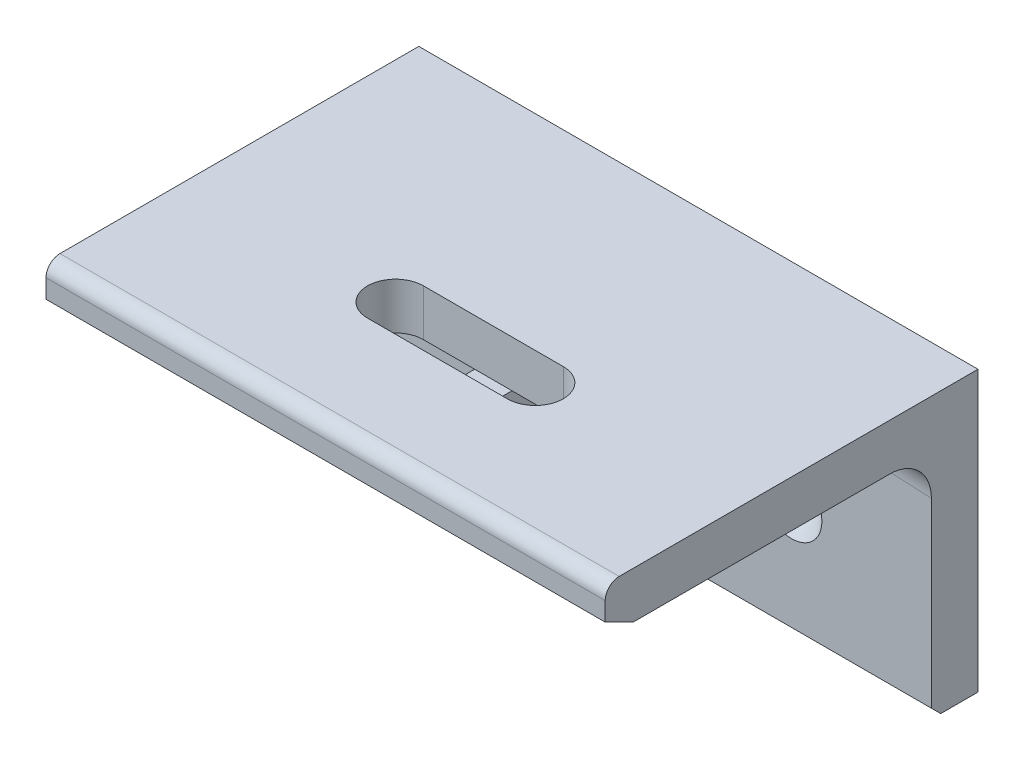
from build123d import *

# Parameters (mm, degrees)
SKETCH_1_W                     = 120
SKETCH_1_H                     = 60
EXTRUDE_1_DEPTH                = 10
SKETCH_2_W                     = 120
SKETCH_2_H                     = 80
EXTRUDE_2_DEPTH                = 10
EXTRUDE_3_DEPTH                = 8
CUT_EXTRUDE_13_DEPTH           = 157.974520392
FILLET_1_R                     = 3
CHAMFER_1_SIZE                 = 2
SKETCH_18_R                    = 6.5
CUT_EXTRUDE_14_DEPTH           = 3.2
CUT_EXTRUDE_14_DRAFT           = -45
CUT_EXTRUDE_14_PROFILE_2_DEPTH = 3.2
CUT_EXTRUDE_14_PROFILE_2_DRAFT = -45
SKETCH_19_R                    = 3.3
CUT_EXTRUDE_15_DEPTH           = 152.327459669
CUT_EXTRUDE_19_DEPTH           = 10


with BuildPart() as part:
    # 草图1 → 凸台-拉伸1 (new body)
    with BuildSketch(Plane.XY):
        with Locations((60, 30)):
            Rectangle(SKETCH_1_W, SKETCH_1_H)
    extrude(amount=EXTRUDE_1_DEPTH)

    # 草图2 → 凸台-拉伸2 (add)
    with BuildSketch(Plane(origin=(0, 50, 0), x_dir=(1, 0, 0), z_dir=(0, 1, 0))):
        with Locations((60, -40)):
            Rectangle(SKETCH_2_W, SKETCH_2_H)
    extrude(amount=EXTRUDE_2_DEPTH)

    # 草图10 for 放样2 → 放样2 section 0
    with BuildSketch(Plane(origin=(0, 0, 0), x_dir=(0, 0, -1), z_dir=(1, 0, 0))):
        with BuildLine():
            Line((-10, 50), (-10, 47))
            # circular arc as an exact rational Bezier (weights 1, cos(half-angle), 1)
            Bezier((-10, 47), (-10, 50), (-13, 50), weights=[1, 0.707106781, 1])
            Line((-13, 50), (-10, 50))
        make_face()
    # 草图11 for 放样2 → 放样2 section 1
    with BuildSketch(Plane(origin=(120, 0, 0), x_dir=(0, 0, -1), z_dir=(1, 0, 0))):
        with BuildLine():
            Line((-10, 50), (-10, 41))
            Bezier((-10, 41), (-10, 50), (-19, 50), weights=[1, 0.707106781, 1])
            Line((-19, 50), (-10, 50))
        make_face()
    loft()

    # 草图14 → 凸台-拉伸3 (add)
    with BuildSketch(Plane(origin=(56, 0, 0), x_dir=(0, 0, -1), z_dir=(1, 0, 0))):
        Polygon((-10, 50), (-10, 10), (-60, 50), align=None)
    extrude(amount=EXTRUDE_3_DEPTH)

    # 草图17 → 切除-拉伸13 (cut, through all)
    with BuildSketch(Plane(origin=(-1, 0, 0), x_dir=(0, 0, -1), z_dir=(1, 0, 0))):
        Polygon((-80, 50), (-74, 50), (-80, 53), align=None)
    extrude(amount=CUT_EXTRUDE_13_DEPTH, mode=Mode.SUBTRACT)

    # 圆角1
    fillet_1_edges = [part.edges().sort_by_distance(p)[0] for p in [
        (60, 60, 80),
    ]]
    fillet(fillet_1_edges, radius=FILLET_1_R)

    # 倒角1
    chamfer_1_edges = [part.edges().sort_by_distance(p)[0] for p in [
        (60, 0, 10),
    ]]
    chamfer(chamfer_1_edges, length=CHAMFER_1_SIZE)


with BuildPart() as cut_extrude_14_tool:
    # 草图18 → 切除-拉伸14 (with draft: the straight prism first)
    with BuildSketch(Plane.XY.offset(10)):
        with Locations((30, 25)):
            Circle(SKETCH_18_R)
    extrude(amount=-CUT_EXTRUDE_14_DEPTH)
    # 切除-拉伸14: the draft: its side faces are tilted about the plane it starts from
    cut_extrude_14_sides = [cut_extrude_14_tool.faces().sort_by_distance(p)[0] for p in [
        (23.5, 25, 8.4),
    ]]
    draft(cut_extrude_14_sides, Plane.XY.offset(10), CUT_EXTRUDE_14_DRAFT)


with BuildPart() as part_1:
    add(part.part)

    # 切除-拉伸14: cut by cut_extrude_14_tool
    add(cut_extrude_14_tool.part, mode=Mode.SUBTRACT)


with BuildPart() as cut_extrude_14_profile_2_tool:
    # 草图18 → 切除-拉伸14 profile 2 (with draft: the straight prism first)
    with BuildSketch(Plane.XY.offset(10)):
        with Locations((90, 25)):
            Circle(SKETCH_18_R)
    extrude(amount=-CUT_EXTRUDE_14_PROFILE_2_DEPTH)
    # 切除-拉伸14 profile 2: the draft: its side faces are tilted about the plane it starts from
    cut_extrude_14_profile_2_sides = [cut_extrude_14_profile_2_tool.faces().sort_by_distance(p)[0] for p in [
        (83.5, 25, 8.4),
    ]]
    draft(cut_extrude_14_profile_2_sides, Plane.XY.offset(10), CUT_EXTRUDE_14_PROFILE_2_DRAFT)


with BuildPart() as part_2:
    add(part_1.part)

    # 切除-拉伸14 profile 2: cut by cut_extrude_14_profile_2_tool
    add(cut_extrude_14_profile_2_tool.part, mode=Mode.SUBTRACT)

    # 草图19 → 切除-拉伸15 (cut, through all)
    with BuildSketch(Plane.XY.offset(10)):
        with Locations((30, 25)):
            Circle(SKETCH_19_R)
        with Locations((90, 25)):
            Circle(SKETCH_19_R)
    extrude(amount=-CUT_EXTRUDE_15_DEPTH, mode=Mode.SUBTRACT)

    # 草图22 → 切除-拉伸19 (cut)
    with BuildSketch(Plane(origin=(0, 60, 0), x_dir=(1, 0, 0), z_dir=(0, 1, 0))):
        with BuildLine():
            Line((45, -44), (75, -44))
            ThreePointArc((75, -44), (81, -50), (75, -56))
            Line((75, -56), (45, -56))
            ThreePointArc((45, -56), (39, -50), (45, -44))
        make_face()
    extrude(amount=-CUT_EXTRUDE_19_DEPTH, mode=Mode.SUBTRACT)


solid = part_2.part
